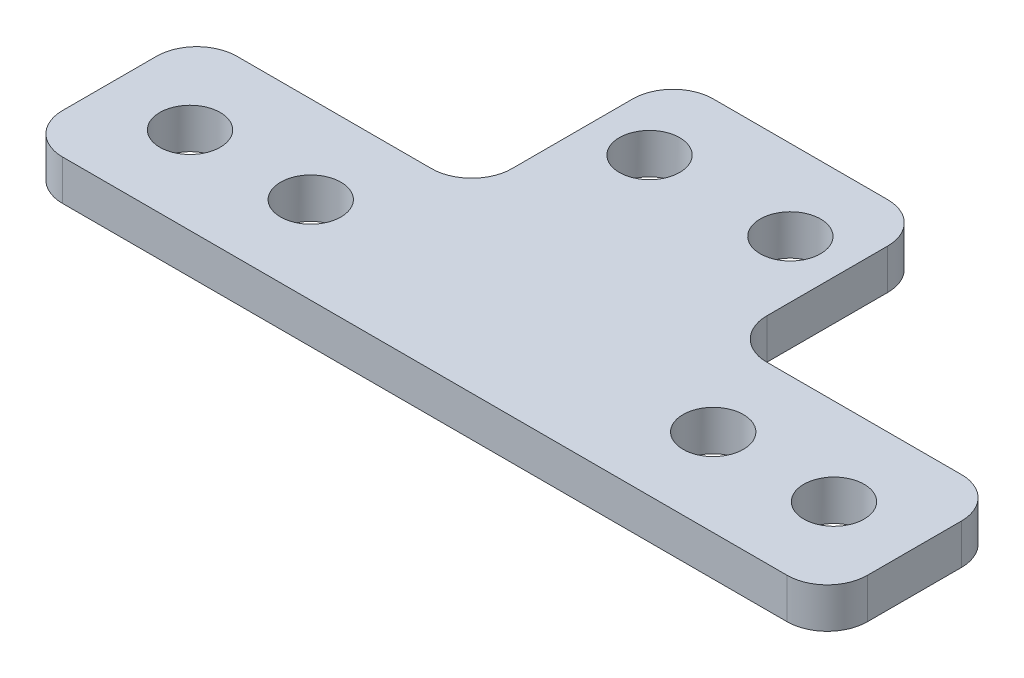
from build123d import *

# Parameters (mm, degrees)
ODGI_CIE_BAZOWE1_DEPTH  = 3
OTW_R_POD_RUB_M41_D     = 4.5
OTW_R_POD_RUB_M41_DEPTH = 10
OTW_R_POD_RUB_M41_TIP   = 1.351936393
ZAOKR_GLENIE1_R         = 3


# Sheet-metal steps are written as plain solids
with BuildPart() as part:
    # Szkic1 → Odgięcie bazowe1 (new body)
    with BuildSketch(Plane(origin=(0, 0, 0), x_dir=(1, 0, 0), z_dir=(0, 1, 0))):
        Polygon((9.5, 15), (-9.5, 15), (-9.5, 0), (-30, 0), (-30, -13), (30, -13), (30, 0), (9.5, 0), align=None)
    extrude(amount=-ODGI_CIE_BAZOWE1_DEPTH)

    # Otwór pod śrubę M41
    with Locations(Plane(origin=(0, 0, 0), x_dir=(1, 0, 0), z_dir=(0, 1, 0))):
        with Locations((-5.25, 9), (5.25, 9), (-15, -6.5), (15, -6.5), (-24, -6.5), (24, -6.5)):
            Hole(OTW_R_POD_RUB_M41_D / 2, depth=OTW_R_POD_RUB_M41_DEPTH)
            with Locations((0, 0, -(OTW_R_POD_RUB_M41_DEPTH + OTW_R_POD_RUB_M41_TIP / 2))):  # 118° drill point
                Cone(0, OTW_R_POD_RUB_M41_D / 2, OTW_R_POD_RUB_M41_TIP, mode=Mode.SUBTRACT)

    # Zaokrąglenie1
    zaokr_glenie1_edges = [part.edges().sort_by_distance(p)[0] for p in [
        (-9.5, -1.5, -15),
        (9.5, -1.5, -15),
        (9.5, -1.5, 0),
        (30, -1.5, 0),
        (30, -1.5, 13),
        (-30, -1.5, 13),
        (-30, -1.5, 0),
        (-9.5, -1.5, 0),
    ]]
    fillet(zaokr_glenie1_edges, radius=ZAOKR_GLENIE1_R)


solid = part.part
